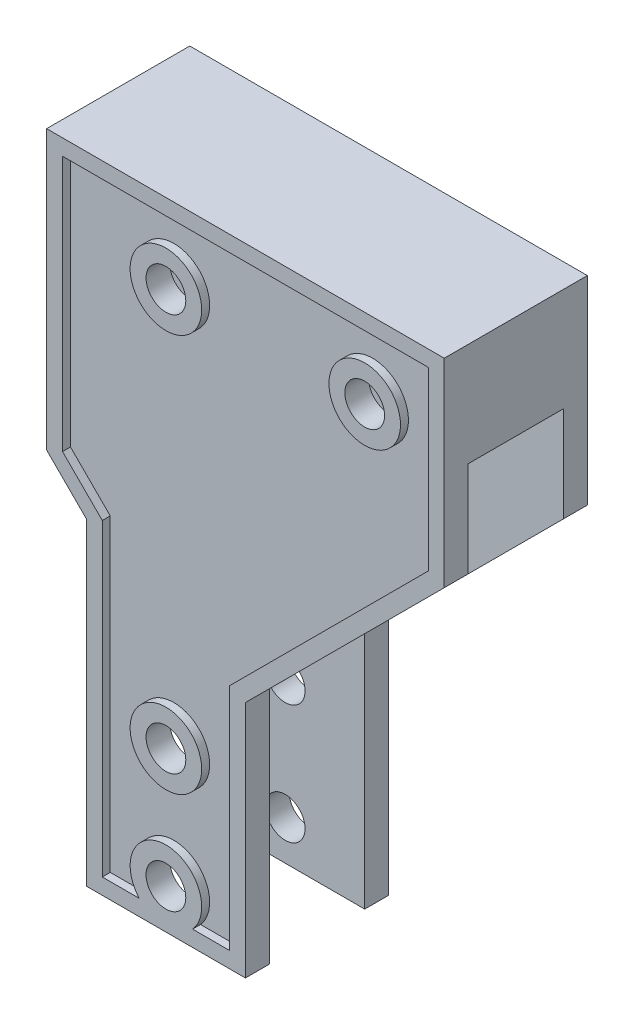
from build123d import *

# Parameters (mm, degrees)
ESQUISSE1_R                  = 2.5
BOSS_EXTRU_1_DEPTH           = 18
COQUE2_T                     = -3
ENL_V_MAT_EXTRU_1_DEPTH      = 94.536089292
ENL_V_MAT_EXTRU_1_DEPTH_BACK = 94.536089292
ESQUISSE2_W                  = 12
ESQUISSE2_H                  = 15
ESQUISSE3_R                  = 2.5
ENL_V_MAT_EXTRU_3_DEPTH      = 97.041657628
SHELL2_OUTLINE_R             = 4.5
SHELL2_DEPTH                 = 1
SHELL2_START                 = 17
SHELL2_2_OUTLINE_R           = 4.5
SHELL2_2_DEPTH               = 1


# Read off the part's stored shape, not the designer's step: Shell2
with BuildPart() as part:
    # Esquisse1 → Boss.-Extru.1 (new body)
    with BuildSketch(Plane.XY):
        Polygon((-50, 45), (-45, 40), (-45, 0), (-25, 0), (-25, 30), (0, 55), (0, 80), (-50, 80), align=None)
        with Locations((-35, 5)):
            Circle(ESQUISSE1_R, mode=Mode.SUBTRACT)
        with Locations((-35, 20)):
            Circle(ESQUISSE1_R, mode=Mode.SUBTRACT)
    extrude(amount=BOSS_EXTRU_1_DEPTH)

    # Coque2
    coque2_openings = [part.faces().sort_by_distance(p)[0] for p in [
        (-35, 0, 9),
        (-45, 20, 9),
        (-47.5, 42.5, 9),
        (-12.5, 42.5, 9),
        (-25, 15, 9),
        (-37.5, 5, 9),
        (-37.5, 20, 9),
    ]]
    offset(amount=COQUE2_T, openings=coque2_openings, kind=Kind.INTERSECTION)

    # Esquisse2 → Enlèv. mat.-Extru.1 (cut, two sides: drawn at the far end of the back side and taken through both)
    with BuildSketch(Plane.ZY.offset(45).offset(-ENL_V_MAT_EXTRU_1_DEPTH_BACK)):
        with Locations((9, 59.5)):
            Rectangle(ESQUISSE2_W, ESQUISSE2_H)
    extrude(amount=ENL_V_MAT_EXTRU_1_DEPTH + ENL_V_MAT_EXTRU_1_DEPTH_BACK, mode=Mode.SUBTRACT)

    # Esquisse3 → Enlèv. mat.-Extru.3 (cut, through all)
    with BuildSketch(Plane.XY.offset(18)):
        with Locations((-35, 70)):
            Circle(ESQUISSE3_R)
        with Locations((-10, 70)):
            Circle(ESQUISSE3_R)
    extrude(amount=-ENL_V_MAT_EXTRU_3_DEPTH, mode=Mode.SUBTRACT)

    # Shell2 outline → Shell2 (cut)
    with BuildSketch(Plane.XY):
        with BuildLine():
            Line((-43, 2), (-38.354101966, 2))
            ThreePointArc((-38.354101966, 2), (-35, 9.5), (-31.645898034, 2))
            Line((-31.645898034, 2), (-27, 2))
            Line((-27, 2), (-27, 30.828427125))
            Line((-27, 30.828427125), (-2, 55.828427125))
            Line((-2, 55.828427125), (-2, 78))
            Line((-2, 78), (-48, 78))
            Line((-48, 78), (-48, 45.828427125))
            Line((-48, 45.828427125), (-43, 40.828427125))
            Line((-43, 40.828427125), (-43, 2))
        make_face()
        with Locations((-35, 20)):
            Circle(SHELL2_OUTLINE_R, mode=Mode.SUBTRACT)
        with Locations((-35, 70)):
            Circle(SHELL2_OUTLINE_R, mode=Mode.SUBTRACT)
        with Locations((-10, 70)):
            Circle(SHELL2_OUTLINE_R, mode=Mode.SUBTRACT)
    extrude(amount=SHELL2_DEPTH, mode=Mode.SUBTRACT)

    # Shell2 2 outline → Shell2 2 (cut)
    with BuildSketch(Plane.XY.offset(SHELL2_START)):
        with BuildLine():
            Line((-43, 2), (-38.354101966, 2))
            ThreePointArc((-38.354101966, 2), (-35, 9.5), (-31.645898034, 2))
            Line((-31.645898034, 2), (-27, 2))
            Line((-27, 2), (-27, 30.828427125))
            Line((-27, 30.828427125), (-2, 55.828427125))
            Line((-2, 55.828427125), (-2, 78))
            Line((-2, 78), (-48, 78))
            Line((-48, 78), (-48, 45.828427125))
            Line((-48, 45.828427125), (-43, 40.828427125))
            Line((-43, 40.828427125), (-43, 2))
        make_face()
        with Locations((-35, 20)):
            Circle(SHELL2_2_OUTLINE_R, mode=Mode.SUBTRACT)
        with Locations((-35, 70)):
            Circle(SHELL2_2_OUTLINE_R, mode=Mode.SUBTRACT)
        with Locations((-10, 70)):
            Circle(SHELL2_2_OUTLINE_R, mode=Mode.SUBTRACT)
    extrude(amount=SHELL2_2_DEPTH, mode=Mode.SUBTRACT)


solid = part.part
